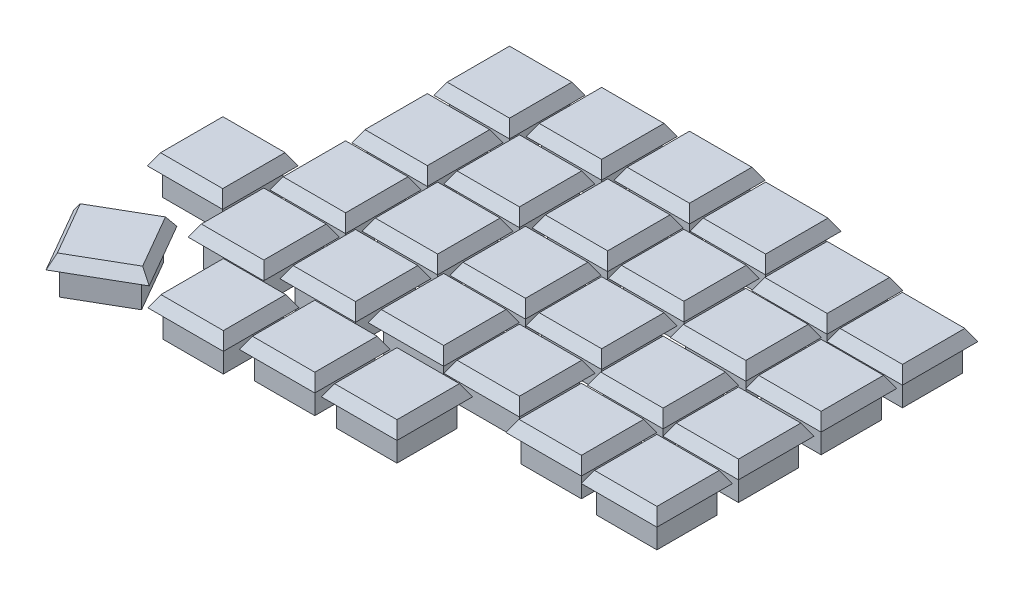
from build123d import *

# Parameters (mm, degrees)
BOSS_EXTRUDE1_DEPTH    = 6.35
BOSS_EXTRUDE1_2_DEPTH  = 6.35
BOSS_EXTRUDE1_3_DEPTH  = 6.35
BOSS_EXTRUDE1_4_DEPTH  = 6.35
BOSS_EXTRUDE1_5_DEPTH  = 6.35
BOSS_EXTRUDE1_6_DEPTH  = 6.35
BOSS_EXTRUDE1_7_DEPTH  = 6.35
BOSS_EXTRUDE1_8_DEPTH  = 6.35
BOSS_EXTRUDE1_9_DEPTH  = 6.35
BOSS_EXTRUDE1_10_DEPTH = 6.35
BOSS_EXTRUDE1_11_DEPTH = 6.35
BOSS_EXTRUDE1_12_DEPTH = 6.35
BOSS_EXTRUDE1_13_DEPTH = 6.35
BOSS_EXTRUDE1_14_DEPTH = 6.35
BOSS_EXTRUDE1_15_DEPTH = 6.35
BOSS_EXTRUDE1_16_DEPTH = 6.35
BOSS_EXTRUDE1_17_DEPTH = 6.35
BOSS_EXTRUDE1_18_DEPTH = 6.35
BOSS_EXTRUDE1_19_DEPTH = 6.35
BOSS_EXTRUDE1_20_DEPTH = 6.35
BOSS_EXTRUDE1_21_DEPTH = 6.35
BOSS_EXTRUDE1_22_DEPTH = 6.35
BOSS_EXTRUDE1_23_DEPTH = 6.35
BOSS_EXTRUDE1_24_DEPTH = 6.35
BOSS_EXTRUDE1_25_DEPTH = 6.35
BOSS_EXTRUDE1_26_DEPTH = 6.35
BOSS_EXTRUDE1_27_DEPTH = 6.35
BOSS_EXTRUDE1_28_DEPTH = 6.35
BOSS_EXTRUDE1_29_DEPTH = 6.35
BOSS_EXTRUDE2_DEPTH    = 2.65
BOSS_EXTRUDE2_TAPER    = 30


# Read off the part's stored shape, not the designer's step: Body-Delete/Keep 1
with BuildPart() as part:
    # Sketch2 → Boss-Extrude1 (new body)
    with BuildSketch(Plane(origin=(0, 7.999999998, 0), x_dir=(1, 0, 0), z_dir=(0, 1, 0))):
        Polygon((6.015741732, -133.051248448), (6.015740348, -147.051247656), (20.01593792, -147.05124904), (20.015939305, -133.051249832), align=None)
    extrude(amount=BOSS_EXTRUDE1_DEPTH)



with BuildPart() as body_2:
    # Sketch2 → Boss-Extrude1 2 (new body)
    with BuildSketch(Plane(origin=(0, 7.999999998, 0), x_dir=(1, 0, 0), z_dir=(0, 1, 0))):
        Polygon((1.01574236, -129.553445417), (1.015743745, -115.553446208), (-12.984453828, -115.553444824), (-12.984455212, -129.553444032), align=None)
    extrude(amount=BOSS_EXTRUDE1_2_DEPTH)


with BuildPart() as body_3:
    # Sketch2 → Boss-Extrude1 3 (new body)
    with BuildSketch(Plane(origin=(0, 7.999999998, 0), x_dir=(1, 0, 0), z_dir=(0, 1, 0))):
        Polygon((96.216731883, -144.653460079), (96.216733268, -130.653460871), (82.216535695, -130.653459486), (82.216534311, -144.653458695), align=None)
    extrude(amount=BOSS_EXTRUDE1_3_DEPTH)


with BuildPart() as body_4:
    # Sketch2 → Boss-Extrude1 4 (new body)
    with BuildSketch(Plane(origin=(0, 7.999999998, 0), x_dir=(1, 0, 0), z_dir=(0, 1, 0))):
        Polygon((-13.033254695, -148.552145956), (0.966942877, -148.55214734), (0.966944262, -134.552148132), (-13.033253311, -134.552146748), align=None)
    extrude(amount=BOSS_EXTRUDE1_4_DEPTH)


with BuildPart() as body_5:
    # Sketch2 → Boss-Extrude1 5 (new body)
    with BuildSketch(Plane(origin=(0, 7.999999998, 0), x_dir=(1, 0, 0), z_dir=(0, 1, 0))):
        Polygon((82.216537574, -111.650553762), (82.21653619, -125.650560599), (96.216733762, -125.650561984), (96.216735147, -111.650555146), align=None)
    extrude(amount=BOSS_EXTRUDE1_5_DEPTH)


with BuildPart() as body_6:
    # Sketch2 → Boss-Extrude1 6 (new body)
    with BuildSketch(Plane(origin=(0, 7.999999998, 0), x_dir=(1, 0, 0), z_dir=(0, 1, 0))):
        Polygon((102.153933672, -147.989550565), (95.153833686, -160.113954095), (107.278431766, -167.114061709), (114.278432569, -154.98965818), align=None)
    extrude(amount=BOSS_EXTRUDE1_6_DEPTH)


with BuildPart() as body_7:
    # Sketch2 → Boss-Extrude1 7 (new body)
    with BuildSketch(Plane(origin=(0, 7.999999998, 0), x_dir=(1, 0, 0), z_dir=(0, 1, 0))):
        Polygon((25.116235501, -128.352245475), (25.116234117, -142.352244683), (39.116439319, -142.352246067), (39.116440703, -128.352246859), align=None)
    extrude(amount=BOSS_EXTRUDE1_7_DEPTH)


with BuildPart() as body_8:
    # Sketch2 → Boss-Extrude1 8 (new body)
    with BuildSketch(Plane(origin=(0, 7.999999998, 0), x_dir=(1, 0, 0), z_dir=(0, 1, 0))):
        Polygon((25.115443933, -109.25124863), (25.115442549, -123.251247838), (39.115640121, -123.251249223), (39.115641506, -109.251250014), align=None)
    extrude(amount=BOSS_EXTRUDE1_8_DEPTH)


with BuildPart() as body_9:
    # Sketch2 → Boss-Extrude1 9 (new body)
    with BuildSketch(Plane(origin=(0, 7.999999998, 0), x_dir=(1, 0, 0), z_dir=(0, 1, 0))):
        Polygon((44.115442987, -107.95125516), (44.115441603, -121.951246739), (58.115639176, -121.951248123), (58.11564056, -107.951256544), align=None)
    extrude(amount=BOSS_EXTRUDE1_9_DEPTH)


with BuildPart() as body_10:
    # Sketch2 → Boss-Extrude1 10 (new body)
    with BuildSketch(Plane(origin=(0, 7.999999998, 0), x_dir=(1, 0, 0), z_dir=(0, 1, 0))):
        Polygon((44.115444875, -88.852951491), (44.115443491, -102.853049882), (58.115641064, -102.853051266), (58.115642448, -88.852952875), align=None)
    extrude(amount=BOSS_EXTRUDE1_10_DEPTH)


with BuildPart() as body_11:
    # Sketch2 → Boss-Extrude1 11 (new body)
    with BuildSketch(Plane(origin=(0, 7.999999998, 0), x_dir=(1, 0, 0), z_dir=(0, 1, 0))):
        Polygon((44.116638923, -126.95144482), (44.116637539, -140.951444029), (58.116835112, -140.951445413), (58.116836496, -126.951446205), align=None)
    extrude(amount=BOSS_EXTRUDE1_11_DEPTH)


with BuildPart() as body_12:
    # Sketch2 → Boss-Extrude1 12 (new body)
    with BuildSketch(Plane(origin=(0, 7.999999998, 0), x_dir=(1, 0, 0), z_dir=(0, 1, 0))):
        Polygon((25.11154145, -71.15175585), (25.111540066, -85.151755058), (39.111745268, -85.151756442), (39.111746652, -71.151757234), align=None)
    extrude(amount=BOSS_EXTRUDE1_12_DEPTH)


with BuildPart() as body_13:
    # Sketch2 → Boss-Extrude1 13 (new body)
    with BuildSketch(Plane(origin=(0, 7.999999998, 0), x_dir=(1, 0, 0), z_dir=(0, 1, 0))):
        Polygon((53.716436478, -147.301847451), (53.716435094, -161.301846659), (67.716632667, -161.301848044), (67.716634051, -147.301848835), align=None)
    extrude(amount=BOSS_EXTRUDE1_13_DEPTH)


with BuildPart() as body_14:
    # Sketch2 → Boss-Extrude1 14 (new body)
    with BuildSketch(Plane(origin=(0, 7.999999998, 0), x_dir=(1, 0, 0), z_dir=(0, 1, 0))):
        Polygon((48.616133117, -147.302945579), (34.615637998, -147.302944195), (34.615636613, -161.303355391), (48.616131732, -161.303356775), align=None)
    extrude(amount=BOSS_EXTRUDE1_14_DEPTH)


with BuildPart() as body_15:
    # Sketch2 → Boss-Extrude1 15 (new body)
    with BuildSketch(Plane(origin=(0, 7.999999998, 0), x_dir=(1, 0, 0), z_dir=(0, 1, 0))):
        Polygon((1.017834713, -110.351046295), (1.017836097, -96.35314517), (-12.98255984, -96.353143786), (-12.982561224, -110.351044911), align=None)
    extrude(amount=BOSS_EXTRUDE1_15_DEPTH)


with BuildPart() as body_16:
    # Sketch2 → Boss-Extrude1 16 (new body)
    with BuildSketch(Plane(origin=(0, 7.999999998, 0), x_dir=(1, 0, 0), z_dir=(0, 1, 0))):
        Polygon((77.215538643, -109.253557858), (63.21534107, -109.253556474), (63.215339686, -123.253555682), (77.215537259, -123.253557067), align=None)
    extrude(amount=BOSS_EXTRUDE1_16_DEPTH)


with BuildPart() as body_17:
    # Sketch2 → Boss-Extrude1 17 (new body)
    with BuildSketch(Plane(origin=(0, 7.999999998, 0), x_dir=(1, 0, 0), z_dir=(0, 1, 0))):
        Polygon((6.015549013, -75.952351835), (6.015547629, -89.952351043), (20.015745202, -89.952352427), (20.015746586, -75.952353219), align=None)
    extrude(amount=BOSS_EXTRUDE1_17_DEPTH)


with BuildPart() as body_18:
    # Sketch2 → Boss-Extrude1 18 (new body)
    with BuildSketch(Plane(origin=(0, 7.999999998, 0), x_dir=(1, 0, 0), z_dir=(0, 1, 0))):
        Polygon((82.215540002, -92.653354824), (82.215538617, -106.653354032), (96.21573619, -106.653355416), (96.215737574, -92.653356208), align=None)
    extrude(amount=BOSS_EXTRUDE1_18_DEPTH)


with BuildPart() as body_19:
    # Sketch2 → Boss-Extrude1 19 (new body)
    with BuildSketch(Plane(origin=(0, 7.999999998, 0), x_dir=(1, 0, 0), z_dir=(0, 1, 0))):
        Polygon((101.364133828, -121.052250375), (101.364132444, -135.052356395), (115.316333498, -135.052357774), (115.316334883, -121.052251754), align=None)
    extrude(amount=BOSS_EXTRUDE1_19_DEPTH)


with BuildPart() as body_20:
    # Sketch2 → Boss-Extrude1 20 (new body)
    with BuildSketch(Plane(origin=(0, 7.999999998, 0), x_dir=(1, 0, 0), z_dir=(0, 1, 0))):
        Polygon((6.01673733, -94.852451474), (6.016735946, -108.852450683), (20.016933518, -108.852452067), (20.016934903, -94.852452859), align=None)
    extrude(amount=BOSS_EXTRUDE1_20_DEPTH)


with BuildPart() as body_21:
    # Sketch2 → Boss-Extrude1 21 (new body)
    with BuildSketch(Plane(origin=(0, 7.999999998, 0), x_dir=(1, 0, 0), z_dir=(0, 1, 0))):
        Polygon((6.030544635, -114.052248974), (6.030543251, -128.052240553), (20.030740823, -128.052241937), (20.030742208, -114.052250358), align=None)
    extrude(amount=BOSS_EXTRUDE1_21_DEPTH)


with BuildPart() as body_22:
    # Sketch2 → Boss-Extrude1 22 (new body)
    with BuildSketch(Plane(origin=(0, 7.999999998, 0), x_dir=(1, 0, 0), z_dir=(0, 1, 0))):
        Polygon((1.017837966, -77.451748534), (-12.982557971, -77.451747149), (-12.982559355, -91.452249898), (1.017836582, -91.452251282), align=None)
    extrude(amount=BOSS_EXTRUDE1_22_DEPTH)


with BuildPart() as body_23:
    # Sketch2 → Boss-Extrude1 23 (new body)
    with BuildSketch(Plane(origin=(0, 7.999999998, 0), x_dir=(1, 0, 0), z_dir=(0, 1, 0))):
        Polygon((44.186346722, -69.762353517), (44.186345338, -83.762451908), (58.186542911, -83.762453292), (58.186544295, -69.762354902), align=None)
    extrude(amount=BOSS_EXTRUDE1_23_DEPTH)


with BuildPart() as body_24:
    # Sketch2 → Boss-Extrude1 24 (new body)
    with BuildSketch(Plane(origin=(0, 7.999999998, 0), x_dir=(1, 0, 0), z_dir=(0, 1, 0))):
        Polygon((72.716931092, -149.552245931), (72.716929708, -163.552351951), (86.71713491, -163.552353335), (86.717136294, -149.552247315), align=None)
    extrude(amount=BOSS_EXTRUDE1_24_DEPTH)


with BuildPart() as body_25:
    # Sketch2 → Boss-Extrude1 25 (new body)
    with BuildSketch(Plane(origin=(0, 7.999999998, 0), x_dir=(1, 0, 0), z_dir=(0, 1, 0))):
        Polygon((82.216541341, -73.552060432), (82.216539957, -87.552059641), (96.216737529, -87.552061025), (96.216738913, -73.552061817), align=None)
    extrude(amount=BOSS_EXTRUDE1_25_DEPTH)


with BuildPart() as body_26:
    # Sketch2 → Boss-Extrude1 26 (new body)
    with BuildSketch(Plane(origin=(0, 7.999999998, 0), x_dir=(1, 0, 0), z_dir=(0, 1, 0))):
        Polygon((63.216243722, -85.151758826), (77.216441295, -85.15176021), (77.216442679, -71.151761002), (63.216245106, -71.151759617), align=None)
    extrude(amount=BOSS_EXTRUDE1_26_DEPTH)


with BuildPart() as body_27:
    # Sketch2 → Boss-Extrude1 27 (new body)
    with BuildSketch(Plane(origin=(0, 7.999999998, 0), x_dir=(1, 0, 0), z_dir=(0, 1, 0))):
        Polygon((63.215339182, -128.352050878), (63.215337798, -142.352050086), (77.21553537, -142.35205147), (77.215536755, -128.352052262), align=None)
    extrude(amount=BOSS_EXTRUDE1_27_DEPTH)


with BuildPart() as body_28:
    # Sketch2 → Boss-Extrude1 28 (new body)
    with BuildSketch(Plane(origin=(0, 7.999999998, 0), x_dir=(1, 0, 0), z_dir=(0, 1, 0))):
        Polygon((25.117444723, -90.15195314), (25.117443338, -104.152051531), (39.117640911, -104.152052915), (39.117642295, -90.151954525), align=None)
    extrude(amount=BOSS_EXTRUDE1_28_DEPTH)


with BuildPart() as body_29:
    # Sketch2 → Boss-Extrude1 29 (new body)
    with BuildSketch(Plane(origin=(0, 7.999999998, 0), x_dir=(1, 0, 0), z_dir=(0, 1, 0))):
        Polygon((77.21644079, -90.252559482), (63.216243218, -90.252558098), (63.216241833, -104.252557306), (77.216439406, -104.25255869), align=None)
    extrude(amount=BOSS_EXTRUDE1_29_DEPTH)


with BuildPart() as part_1:
    add(part.part)

    add(body_2.part)  # Boss-Extrude2 merges body 2

    add(body_3.part)  # Boss-Extrude2 merges body 3

    add(body_4.part)  # Boss-Extrude2 merges body 4

    add(body_5.part)  # Boss-Extrude2 merges body 5

    add(body_6.part)  # Boss-Extrude2 merges body 6

    add(body_7.part)  # Boss-Extrude2 merges body 7

    add(body_8.part)  # Boss-Extrude2 merges body 8

    add(body_9.part)  # Boss-Extrude2 merges body 9

    add(body_10.part)  # Boss-Extrude2 merges body 10

    add(body_11.part)  # Boss-Extrude2 merges body 11

    add(body_12.part)  # Boss-Extrude2 merges body 12

    add(body_13.part)  # Boss-Extrude2 merges body 13

    add(body_14.part)  # Boss-Extrude2 merges body 14

    add(body_15.part)  # Boss-Extrude2 merges body 15

    add(body_16.part)  # Boss-Extrude2 merges body 16

    add(body_17.part)  # Boss-Extrude2 merges body 17

    add(body_18.part)  # Boss-Extrude2 merges body 18

    add(body_19.part)  # Boss-Extrude2 merges body 19

    add(body_20.part)  # Boss-Extrude2 merges body 20

    add(body_21.part)  # Boss-Extrude2 merges body 21

    add(body_22.part)  # Boss-Extrude2 merges body 22

    add(body_23.part)  # Boss-Extrude2 merges body 23

    add(body_24.part)  # Boss-Extrude2 merges body 24

    add(body_25.part)  # Boss-Extrude2 merges body 25

    add(body_26.part)  # Boss-Extrude2 merges body 26

    add(body_27.part)  # Boss-Extrude2 merges body 27

    add(body_28.part)  # Boss-Extrude2 merges body 28

    add(body_29.part)  # Boss-Extrude2 merges body 29
    # Sketch4 → Boss-Extrude2 (add)
    with BuildSketch(Plane(origin=(0, 14.349999998, 0), x_dir=(1, 0, 0), z_dir=(0, 1, 0))):
        Polygon((80.437538442, -108.431353856), (97.993736014, -108.431355592), (97.99373775, -90.875356384), (80.437540177, -90.875354648), align=None)
        Polygon((61.438243393, -88.474557922), (61.438241658, -106.03055713), (78.99443923, -106.030558866), (78.994440966, -88.474559658), align=None)
        Polygon((78.994441119, -86.929760386), (78.994442855, -69.373761177), (61.438245282, -69.373759442), (61.438243546, -86.92975865), align=None)
        Polygon((80.438539781, -89.330059465), (97.994737353, -89.330061201), (97.994739089, -71.774061993), (80.438541517, -71.774060257), align=None)
        Polygon((92.725031849, -160.764746366), (107.929229269, -169.542853272), (116.70722181, -154.338865909), (101.503148764, -145.560759003), align=None)
        Polygon((99.586132268, -136.830356219), (117.094333323, -136.83035795), (117.094335058, -119.27425193), (99.586134004, -119.274250199), align=None)
        Polygon((61.437341246, -107.475556298), (61.43733951, -125.031555507), (78.993537083, -125.031557242), (78.993538819, -107.475558034), align=None)
        Polygon((80.438536014, -127.428560424), (97.994733587, -127.428562159), (97.994735322, -109.872555322), (80.43853775, -109.872553586), align=None)
        Polygon((80.438534135, -146.431458519), (97.994731708, -146.431460255), (97.994733443, -128.875461047), (80.438535871, -128.875459311), align=None)
        Polygon((61.437337622, -144.13004991), (78.993535195, -144.130051646), (78.99353693, -126.574052438), (61.437339358, -126.574050702), align=None)
        Polygon((70.938929532, -165.330351775), (88.495134734, -165.330353511), (88.49513647, -147.774247491), (70.938931268, -147.774245755), align=None)
        Polygon((51.938434918, -163.079846483), (69.494632491, -163.079848219), (69.494634227, -145.523849011), (51.938436654, -145.523847275), align=None)
        Polygon((32.837638173, -145.524944019), (32.837636438, -163.081355215), (50.394131557, -163.081356951), (50.394133293, -145.524945755), align=None)
        Polygon((23.338233941, -144.130244507), (40.894439143, -144.130246243), (40.894440879, -126.574247035), (23.338235677, -126.574245299), align=None)
        Polygon((42.338637363, -142.729443853), (59.894834936, -142.729445589), (59.894836672, -125.17344638), (42.338639099, -125.173444645), align=None)
        Polygon((42.337441427, -123.729246563), (59.893639, -123.729248299), (59.893640736, -106.17325672), (42.337443163, -106.173254984), align=None)
        Polygon((42.408345162, -85.540451732), (59.964542735, -85.540453468), (59.964544471, -67.984355078), (42.408346898, -67.984353342), align=None)
        Polygon((42.337443315, -104.631049706), (59.893640888, -104.631051442), (59.893642624, -87.074953051), (42.337445051, -87.074951315), align=None)
        Polygon((23.339443163, -105.930051355), (40.895640735, -105.930053091), (40.895642471, -88.3739547), (23.339444898, -88.373952965), align=None)
        Polygon((23.337442373, -125.029247663), (40.893639946, -125.029249398), (40.893641681, -107.47325019), (23.337444109, -107.473248454), align=None)
        Polygon((23.33353989, -86.929754882), (40.889745092, -86.929756618), (40.889746828, -69.37375741), (23.333541626, -69.373755674), align=None)
        Polygon((2.744942702, -150.330147516), (2.744944437, -132.774148308), (-14.811253135, -132.774146572), (-14.811254871, -150.33014578), align=None)
        Polygon((4.237740172, -148.82924748), (21.793937745, -148.829249216), (21.79393948, -131.273250008), (4.237741908, -131.273248272), align=None)
        Polygon((4.252543075, -129.830240377), (21.808740648, -129.830242113), (21.808742383, -112.274250534), (4.252544811, -112.274248798), align=None)
        Polygon((2.793743921, -113.775446384), (-14.762453652, -113.775444648), (-14.762455388, -131.331443857), (2.793742185, -131.331445592), align=None)
        Polygon((2.795836273, -94.575145346), (-14.760559664, -94.57514361), (-14.7605614, -112.129044735), (2.795834537, -112.129046471), align=None)
        Polygon((4.23873577, -110.630450507), (21.794933343, -110.630452243), (21.794935078, -93.074453034), (4.238737506, -93.074451298), align=None)
        Polygon((4.237547453, -91.730350867), (21.793745026, -91.730352603), (21.793746762, -74.174353395), (4.237549189, -74.174351659), align=None)
        Polygon((-14.760557795, -75.673746974), (-14.760559531, -93.230249722), (2.795836406, -93.230251458), (2.795838142, -75.67374871), align=None)
    extrude(amount=BOSS_EXTRUDE2_DEPTH, taper=BOSS_EXTRUDE2_TAPER)


with BuildPart() as body_2_2:
    # Mirror1: mirrored copy
    add(part_1.part.mirror(Plane(origin=(0, 0, 0), x_dir=(0, 0, 1), z_dir=(1, 0, 0))))


solid = body_2_2.part
